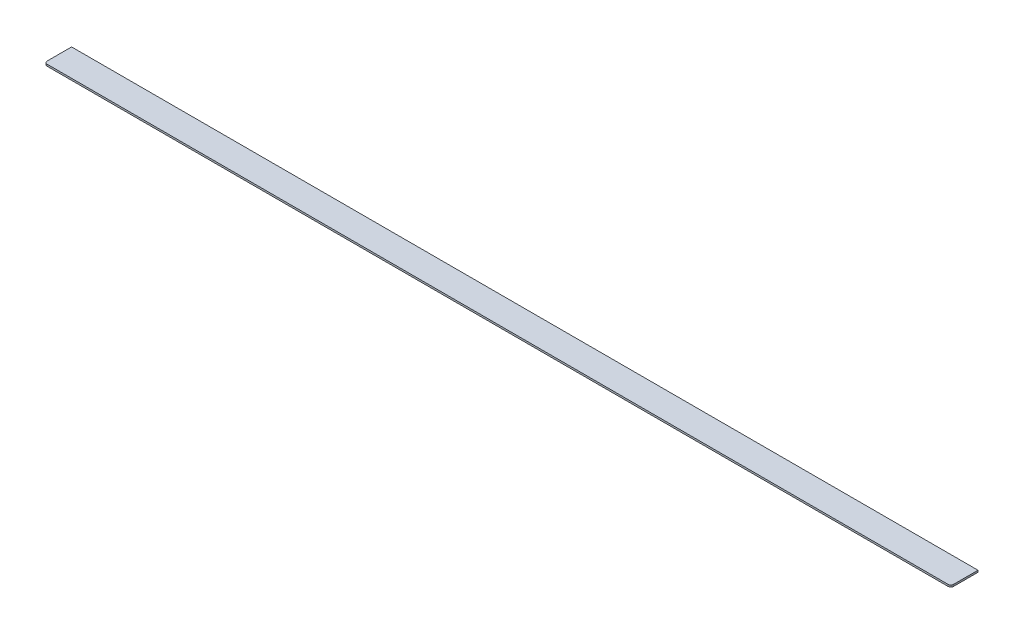
from build123d import *

# Parameters (mm, degrees)
SM_BASE_FLANGE_1_DEPTH = 2


# Sheet-metal steps are written as plain solids
with BuildPart() as part:
    # Sketch 1 → Базовая кромка1 (new body)
    with BuildSketch(Plane(origin=(0, 0, 0), x_dir=(1, 0, 0), z_dir=(0, 1, 0))):
        with BuildLine():
            Line((3, 0), (997, 0))
            ThreePointArc((997, 0), (999.121320344, 0.878679656), (1000, 3))
            Line((1000, 3), (1000, 30))
            Line((1000, 30), (0, 30))
            Line((0, 30), (0, 3))
            ThreePointArc((0, 3), (0.878679656, 0.878679656), (3, 0))
        make_face()
    extrude(amount=-SM_BASE_FLANGE_1_DEPTH)


solid = part.part
